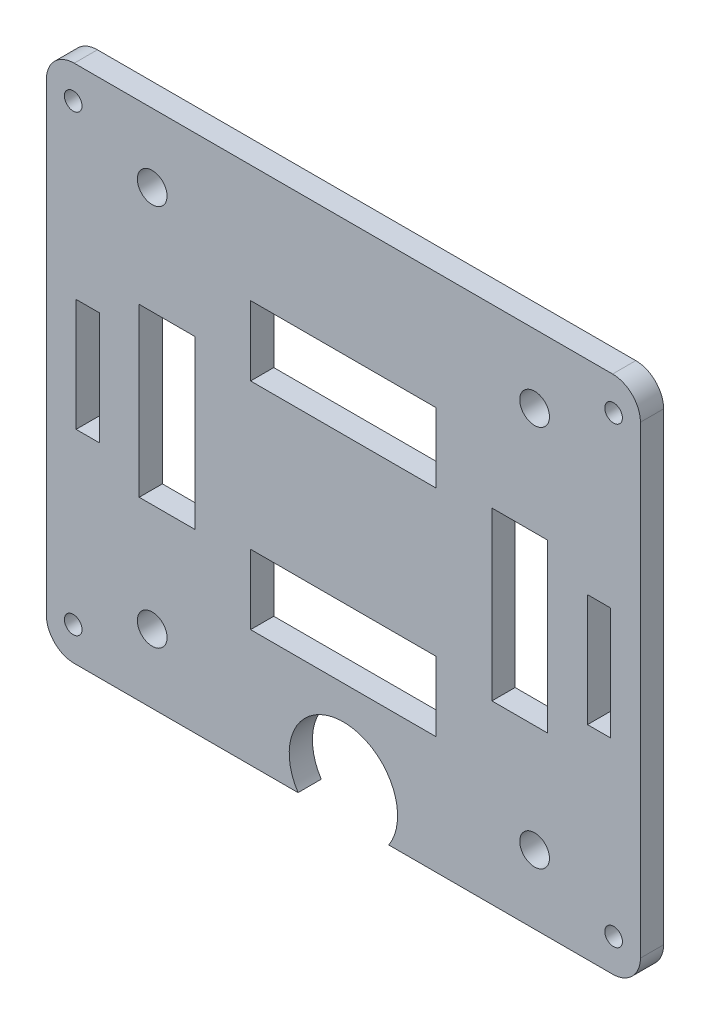
from build123d import *

# Parameters (mm, degrees)
SKETCH1_R           = 0.60325
SKETCH1_R_2         = 1.016
SKETCH1_W           = 12.7
SKETCH1_H           = 4.7625
SKETCH1_W_2         = 1.5875
SKETCH1_H_2         = 7.701016684
SKETCH1_W_3         = 3.81
SKETCH1_H_3         = 11.43
BOSS_EXTRUDE1_DEPTH = 1.5875


with BuildPart() as part:
    # Sketch1 → Boss-Extrude1 (new body)
    with BuildSketch(Plane.XY):
        with BuildLine():
            ThreePointArc((20.32, 15.875), (19.762038418, 17.222038418), (18.415, 17.78))
            Line((18.415, 17.78), (-18.415, 17.78))
            ThreePointArc((-18.415, 17.78), (-19.762038418, 17.222038418), (-20.32, 15.875))
            Line((-20.32, 15.875), (-20.32, -15.875))
            ThreePointArc((-20.32, -15.875), (-19.762038418, -17.222038418), (-18.415, -17.78))
            Line((-18.415, -17.78), (-3.102129359, -17.78))
            ThreePointArc((-3.102129359, -17.78), (-1.060257998, -12.194398512), (3.7084, -15.748))
            ThreePointArc((3.7084, -15.748), (3.553601488, -16.808257998), (3.102129359, -17.78))
            Line((3.102129359, -17.78), (18.415, -17.78))
            ThreePointArc((18.415, -17.78), (19.762038418, -17.222038418), (20.32, -15.875))
            Line((20.32, -15.875), (20.32, 15.875))
        make_face()
        with Locations((-18.484652412, -15.510465022)):
            Circle(SKETCH1_R, mode=Mode.SUBTRACT)
        with Locations((-13.08, -13.08)):
            Circle(SKETCH1_R_2, mode=Mode.SUBTRACT)
        with Locations((18.484652412, -15.510465022)):
            Circle(SKETCH1_R, mode=Mode.SUBTRACT)
        with Locations((13.08, -13.08)):
            Circle(SKETCH1_R_2, mode=Mode.SUBTRACT)
        with Locations((0, -7.366)):
            Rectangle(SKETCH1_W, SKETCH1_H, mode=Mode.SUBTRACT)
        with Locations((-17.49425, 0)):
            Rectangle(SKETCH1_W_2, SKETCH1_H_2, mode=Mode.SUBTRACT)
        with Locations((-12.065, 0)):
            Rectangle(SKETCH1_W_3, SKETCH1_H_3, mode=Mode.SUBTRACT)
        with Locations((-13.08, 13.08)):
            Circle(SKETCH1_R_2, mode=Mode.SUBTRACT)
        with Locations((-18.484652412, 15.510465022)):
            Circle(SKETCH1_R, mode=Mode.SUBTRACT)
        with Locations((0, 7.366)):
            Rectangle(SKETCH1_W, SKETCH1_H, mode=Mode.SUBTRACT)
        with Locations((12.065, 0)):
            Rectangle(SKETCH1_W_3, SKETCH1_H_3, mode=Mode.SUBTRACT)
        with Locations((17.49425, 0)):
            Rectangle(SKETCH1_W_2, SKETCH1_H_2, mode=Mode.SUBTRACT)
        with Locations((13.08, 13.08)):
            Circle(SKETCH1_R_2, mode=Mode.SUBTRACT)
        with Locations((18.484652412, 15.510465022)):
            Circle(SKETCH1_R, mode=Mode.SUBTRACT)
    extrude(amount=BOSS_EXTRUDE1_DEPTH)


solid = part.part
